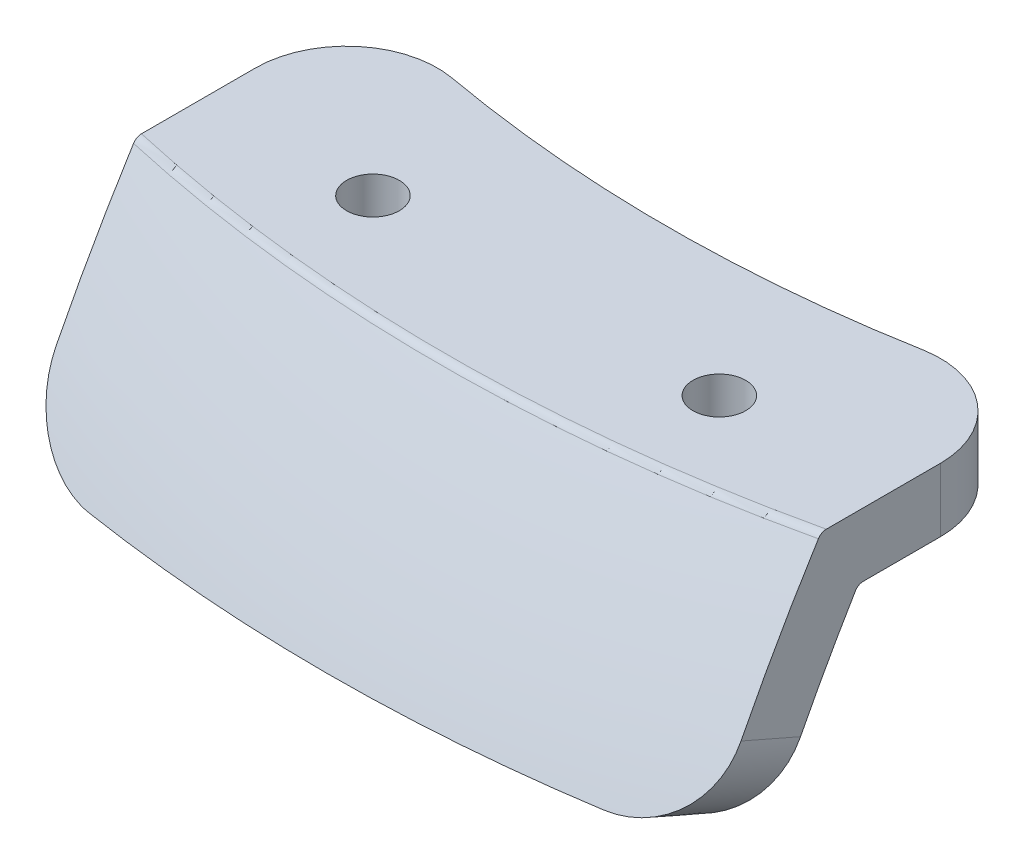
from build123d import *

# Parameters (mm, degrees)
REVOLVE1_ANGLE      = 30
SKETCH5_OUTSIDE_W   = 118.116
SKETCH5_OUTSIDE_H   = 65.786
SKETCH5_OUTSIDE_W_2 = 75.329921726
SKETCH5_OUTSIDE_H_2 = 42.362110511
CUT_EXTRUDE2_DEPTH  = 273.756230171
FILLET1_R           = 10
FILLET2_R           = 1
SKETCH6_R           = 2.9
CUT_EXTRUDE3_DEPTH  = 189.665890372


with BuildPart() as part:
    # Sketch1 → Revolve1 (revolve, symmetric)
    with BuildSketch(Plane(origin=(0, 0, 0), x_dir=(0, 0, -1), z_dir=(1, 0, 0))) as revolve1_sk:
        with BuildLine():
            Line((-182.929658118, 172.831710184), (-176.527920301, 170.000146495))
            ThreePointArc((-176.527920301, 170.000146495), (-171.7595902, 179.99527834), (-166.425900574, 189.700503093))
            Line((-166.425900574, 189.700503093), (-145.526233777, 189.700503093))
            Line((-145.526233777, 189.700503093), (-145.526233777, 196.700503093))
            Line((-145.526233777, 196.700503093), (-170.38485915, 196.700503093))
            ThreePointArc((-170.38485915, 196.700503093), (-177.059924452, 184.977737019), (-182.929658118, 172.831710184))
        make_face()
    revolve(axis=Axis((0, 0, 0), (0, 1, 0)), revolution_arc=REVOLVE1_ANGLE / 2)
    revolve(revolve1_sk.sketch, axis=Axis((0, 0, 0), (0, -1, 0)), revolution_arc=REVOLVE1_ANGLE / 2)

    # Sketch4 → Cut-Revolve1 (revolve, cut)
    with BuildSketch(Plane(origin=(0, 72.974433775, -37.182331171), x_dir=(0, 0.45399049973954475, 0.8910065241883689), z_dir=(0, -0.8910065241883689, 0.45399049973954475))):
        Polygon((219.749406501, 20.731311642), (239.017694648, 22.41706842), (239.148428262, 20.922776373), (219.880140115, 19.237019595), align=None)
    cut_revolve1 = revolve(axis=Axis((-19.237019595, 172.797928469, 158.732308211), (-0.08715574274765844, 0.4522629288245561, 0.887615975361608)), mode=Mode.SUBTRACT)

    # Mirror1: Cut-Revolve1 across plane
    add(cut_revolve1.mirror(Plane(origin=(0, 0, 0), x_dir=(0, 0, 1), z_dir=(1, 0, 0))), mode=Mode.SUBTRACT)

    # Sketch5 outside → Cut-Extrude2 (cut, through all)
    with BuildSketch(Plane(origin=(0, 0, 0), x_dir=(1, 0, 0), z_dir=(0, 1, 0))):
        with Locations((0, -161.749)):
            Rectangle(SKETCH5_OUTSIDE_W, SKETCH5_OUTSIDE_H)
        with Locations((0, -161.748602863)):
            Rectangle(SKETCH5_OUTSIDE_W_2, SKETCH5_OUTSIDE_H_2, mode=Mode.SUBTRACT)
    extrude(amount=CUT_EXTRUDE2_DEPTH, mode=Mode.SUBTRACT)

    # Fillet1
    fillet1_edges = [part.edges().sort_by_distance(p)[0] for p in [
        (-37.664960863, 193.200503093, 140.567547607),
        (37.664960863, 193.200503093, 140.567547607),
        (-37.664960863, 171.41544031, 175.736711543),
        (37.664960863, 171.41544031, 175.736711543),
    ]]
    fillet(fillet1_edges, radius=FILLET1_R)

    # Fillet2
    fillet2_edges = [part.edges().sort_by_distance(p)[0] for p in [
        (0, 196.700503093, 170.38485915),
        (0, 189.700503093, 166.425900574),
    ]]
    fillet(fillet2_edges, radius=FILLET2_R)

    # Sketch6 → Cut-Extrude3 (cut, through all)
    with BuildSketch(Plane(origin=(0, 196.700503093, 0), x_dir=(1, 0, 0), z_dir=(0, 1, 0))):
        with Locations((19.05, -158.75)):
            Circle(SKETCH6_R)
        with Locations((-19.05, -158.75)):
            Circle(SKETCH6_R)
    extrude(amount=-CUT_EXTRUDE3_DEPTH, mode=Mode.SUBTRACT)


solid = part.part
